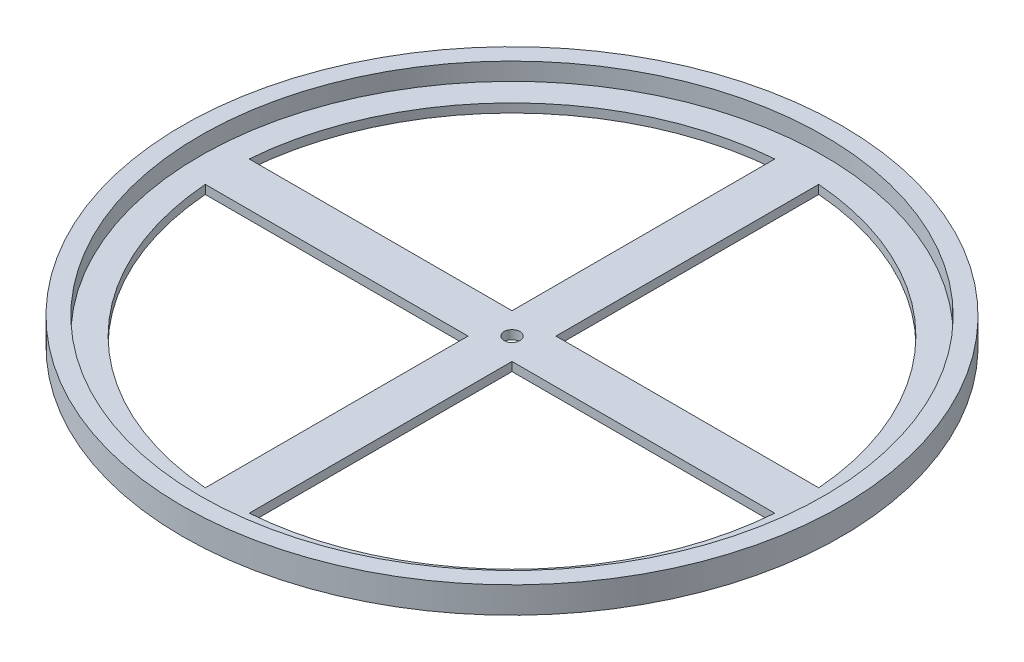
from build123d import *

# Parameters (mm, degrees)
SKETCH1_R           = 37.5
SKETCH1_R_2         = 0.9
BOSS_EXTRUDE1_DEPTH = 1
SKETCH2_R           = 37.5
SKETCH2_R_2         = 35.5
BOSS_EXTRUDE2_DEPTH = 2


with BuildPart() as part:
    # Sketch1 → Boss-Extrude1 (new body)
    with BuildSketch(Plane(origin=(0, 0, 0), x_dir=(1, 0, 0), z_dir=(0, 1, 0))):
        Circle(SKETCH1_R)
        with BuildLine():
            Line((2.5, 2.5), (2.5, 32.403703492))
            ThreePointArc((2.5, 32.403703492), (22.980970389, 22.980970389), (32.403703492, 2.5))
            Line((32.403703492, 2.5), (2.5, 2.5))
        make_face(mode=Mode.SUBTRACT)
        with BuildLine():
            Line((-2.5, 32.403703492), (-2.5, 2.5))
            Line((-2.5, 2.5), (-32.403703492, 2.5))
            ThreePointArc((-32.403703492, 2.5), (-22.980970389, 22.980970389), (-2.5, 32.403703492))
        make_face(mode=Mode.SUBTRACT)
        with BuildLine():
            ThreePointArc((-2.5, -32.403703492), (-22.980970389, -22.980970389), (-32.403703492, -2.5))
            Line((-32.403703492, -2.5), (-2.5, -2.5))
            Line((-2.5, -2.5), (-2.5, -32.403703492))
        make_face(mode=Mode.SUBTRACT)
        with BuildLine():
            ThreePointArc((32.403703492, -2.5), (22.980970389, -22.980970389), (2.5, -32.403703492))
            Line((2.5, -32.403703492), (2.5, -2.5))
            Line((2.5, -2.5), (32.403703492, -2.5))
        make_face(mode=Mode.SUBTRACT)
        Circle(SKETCH1_R_2, mode=Mode.SUBTRACT)
    extrude(amount=BOSS_EXTRUDE1_DEPTH)

    # Sketch2 → Boss-Extrude2 (add)
    with BuildSketch(Plane(origin=(0, 1, 0), x_dir=(1, 0, 0), z_dir=(0, 1, 0))):
        Circle(SKETCH2_R)
        Circle(SKETCH2_R_2, mode=Mode.SUBTRACT)
    extrude(amount=BOSS_EXTRUDE2_DEPTH)


solid = part.part
